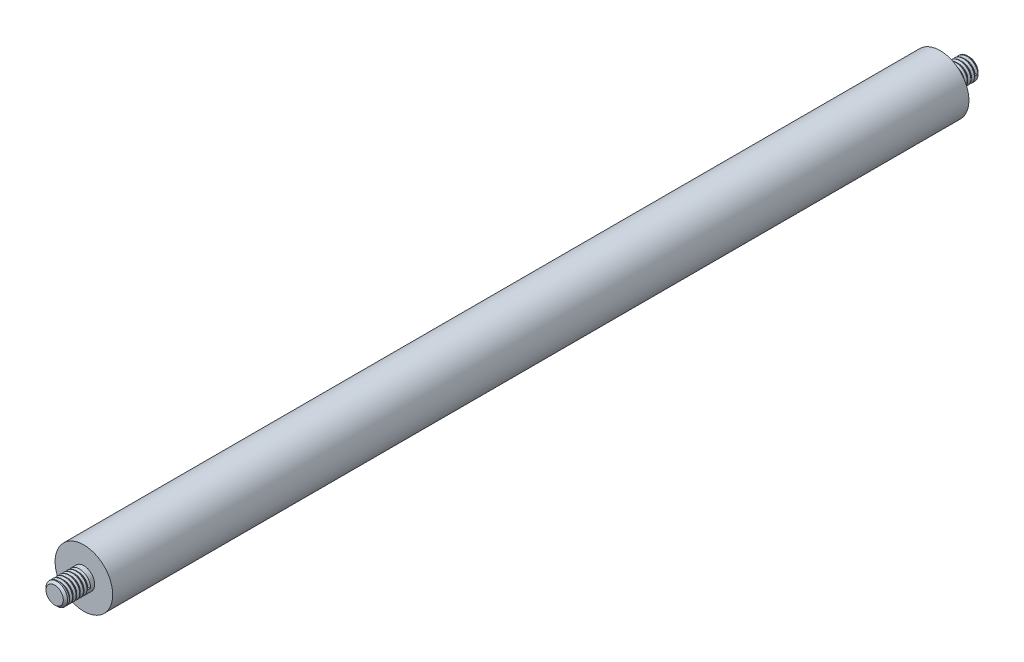
from build123d import *
from build123d.topology import SkipClean

# Parameters (mm, degrees)
SKETCH2_R           = 12.7
BOSS_EXTRUDE1_DEPTH = 377.698
THREAD2_PITCH       = 1.5875
THREAD3_PITCH       = 1.5875


with BuildPart() as part:
    # Sketch2 → Boss-Extrude1 (new body)
    with BuildSketch(Plane.XY):
        Circle(SKETCH2_R)
    extrude(amount=-BOSS_EXTRUDE1_DEPTH)

    # Sketch8 → Revolve1 (revolve)
    with BuildSketch(Plane(origin=(0, 0, 0), x_dir=(0, 0, -1), z_dir=(1, 0, 0))):
        Polygon((0, 0), (-12.8905, 0), (-12.8905, 3.81635), (-11.94435, 4.7625), (0, 4.7625), align=None)
    revolve1 = revolve(axis=Axis((0, 0, 0), (0, 0, 1)))

    # Thread2: the profile of Thread Profile2 profile screwed along a right-hand helix of 5.52 turns, 8 arcs to a turn; built about Z, then put on its axis
    with SkipClean():  # the faces are left unmerged after this step: merging them gives an invalid solid
        thread2_z = Axis((0, 0, 0), (0, 0, 1))
        thread2_corners = [(4.7628, 0, -0.000173205), (4.7628, 0, 1.389235701), (3.903240423, 0, 0.892968748), (3.903240423, 0, 0.496093748)]
        with BuildLine(mode=Mode.PRIVATE) as thread2_profile:
            Line(thread2_corners[0], thread2_corners[1])
            Line(thread2_corners[1], thread2_corners[2])
            Line(thread2_corners[2], thread2_corners[3])
            Line(thread2_corners[3], thread2_corners[0])
        thread2_cap = Face(thread2_profile.wire())
        thread2_turn_angles = [0, 22.5, 45, 67.5, 90, 112.5, 135, 157.5, 180, 202.5, 225, 247.5, 270, 292.5, 315, 337.5, 360]
        thread2_turn_weights = [1, 0.9238795325112867, 1, 0.9238795325112867, 1, 0.9238795325112867, 1, 0.9238795325112867, 1, 0.9238795325112867, 1, 0.9238795325112867, 1, 0.9238795325112867, 1, 0.9238795325112867, 1]
        thread2_turn_rails = [Edge.make_bspline([Vector(p[0], p[1], 0).rotate(thread2_z, thread2_turn_angles[k]) / thread2_turn_weights[k] + Vector(0, 0, p[2] + THREAD2_PITCH * thread2_turn_angles[k] / 360) for k in range(17)], [0, 0, 0, 1, 1, 2, 2, 3, 3, 4, 4, 5, 5, 6, 6, 7, 7, 8, 8, 8], 2, thread2_turn_weights) for p in thread2_corners]
        thread2_turn_sides = [Face.make_surface_from_curves(thread2_turn_rails[p[0]], thread2_turn_rails[p[1]]) for p in [(0, 1), (1, 2), (2, 3), (3, 0)]]
        thread2_last_angles = [1800, 1822.5, 1845, 1867.5, 1890, 1912.5, 1935, 1957.5, 1980, 1983.6, 1987.2]
        thread2_last_weights = [1, 0.9238795325112867, 1, 0.9238795325112867, 1, 0.9238795325112867, 1, 0.9238795325112867, 1, 0.9980267284282717, 1]
        thread2_last_rails = [Edge.make_bspline([Vector(p[0], p[1], 0).rotate(thread2_z, thread2_last_angles[k]) / thread2_last_weights[k] + Vector(0, 0, p[2] + THREAD2_PITCH * thread2_last_angles[k] / 360) for k in range(11)], [0, 0, 0, 1, 1, 2, 2, 3, 3, 4, 4, 5, 5, 5], 2, thread2_last_weights) for p in thread2_corners]
        thread2_last_sides = [Face.make_surface_from_curves(thread2_last_rails[p[0]], thread2_last_rails[p[1]]) for p in [(0, 1), (1, 2), (2, 3), (3, 0)]]
        thread2 = Plane(origin=(0, 0, 11.94435), x_dir=(-1, 0, 0), z_dir=(0, 0, -1)) * Solid(Shell([*[p.moved(Location((0, 0, THREAD2_PITCH * i))) for i in range(5) for p in thread2_turn_sides], *thread2_last_sides, thread2_cap, thread2_cap.rotate(thread2_z, 1987.2).moved(Location((0, 0, THREAD2_PITCH * 1987.2 / 360)))]))
        add(thread2, mode=Mode.SUBTRACT)

    # Mirror3: Revolve1 across plane
    with SkipClean():  # the faces are left unmerged after this step: merging them gives an invalid solid
        add(revolve1.mirror(Plane.XY.offset(-188.849)))

    # Thread3: the profile of Thread Profile3 profile screwed along a right-hand helix of 5.52 turns, 8 arcs to a turn; built about Z, then put on its axis
    with SkipClean():  # the faces are left unmerged after this step: merging them gives an invalid solid
        thread3_z = Axis((0, 0, 0), (0, 0, 1))
        thread3_corners = [(4.7628, 0, -0.000173205), (4.7628, 0, 1.389235701), (3.903240423, 0, 0.892968748), (3.903240423, 0, 0.496093748)]
        with BuildLine(mode=Mode.PRIVATE) as thread3_profile:
            Line(thread3_corners[0], thread3_corners[1])
            Line(thread3_corners[1], thread3_corners[2])
            Line(thread3_corners[2], thread3_corners[3])
            Line(thread3_corners[3], thread3_corners[0])
        thread3_cap = Face(thread3_profile.wire())
        thread3_turn_angles = [0, 22.5, 45, 67.5, 90, 112.5, 135, 157.5, 180, 202.5, 225, 247.5, 270, 292.5, 315, 337.5, 360]
        thread3_turn_weights = [1, 0.9238795325112867, 1, 0.9238795325112867, 1, 0.9238795325112867, 1, 0.9238795325112867, 1, 0.9238795325112867, 1, 0.9238795325112867, 1, 0.9238795325112867, 1, 0.9238795325112867, 1]
        thread3_turn_rails = [Edge.make_bspline([Vector(p[0], p[1], 0).rotate(thread3_z, thread3_turn_angles[k]) / thread3_turn_weights[k] + Vector(0, 0, p[2] + THREAD3_PITCH * thread3_turn_angles[k] / 360) for k in range(17)], [0, 0, 0, 1, 1, 2, 2, 3, 3, 4, 4, 5, 5, 6, 6, 7, 7, 8, 8, 8], 2, thread3_turn_weights) for p in thread3_corners]
        thread3_turn_sides = [Face.make_surface_from_curves(thread3_turn_rails[p[0]], thread3_turn_rails[p[1]]) for p in [(0, 1), (1, 2), (2, 3), (3, 0)]]
        thread3_last_angles = [1800, 1822.5, 1845, 1867.5, 1890, 1912.5, 1935, 1957.5, 1980, 1983.6, 1987.2]
        thread3_last_weights = [1, 0.9238795325112867, 1, 0.9238795325112867, 1, 0.9238795325112867, 1, 0.9238795325112867, 1, 0.9980267284282717, 1]
        thread3_last_rails = [Edge.make_bspline([Vector(p[0], p[1], 0).rotate(thread3_z, thread3_last_angles[k]) / thread3_last_weights[k] + Vector(0, 0, p[2] + THREAD3_PITCH * thread3_last_angles[k] / 360) for k in range(11)], [0, 0, 0, 1, 1, 2, 2, 3, 3, 4, 4, 5, 5, 5], 2, thread3_last_weights) for p in thread3_corners]
        thread3_last_sides = [Face.make_surface_from_curves(thread3_last_rails[p[0]], thread3_last_rails[p[1]]) for p in [(0, 1), (1, 2), (2, 3), (3, 0)]]
        thread3 = Plane(origin=(0, 0, -389.64235), x_dir=(1, 0, 0), z_dir=(0, 0, 1)) * Solid(Shell([*[p.moved(Location((0, 0, THREAD3_PITCH * i))) for i in range(5) for p in thread3_turn_sides], *thread3_last_sides, thread3_cap, thread3_cap.rotate(thread3_z, 1987.2).moved(Location((0, 0, THREAD3_PITCH * 1987.2 / 360)))]))
        add(thread3, mode=Mode.SUBTRACT)


solid = part.part
